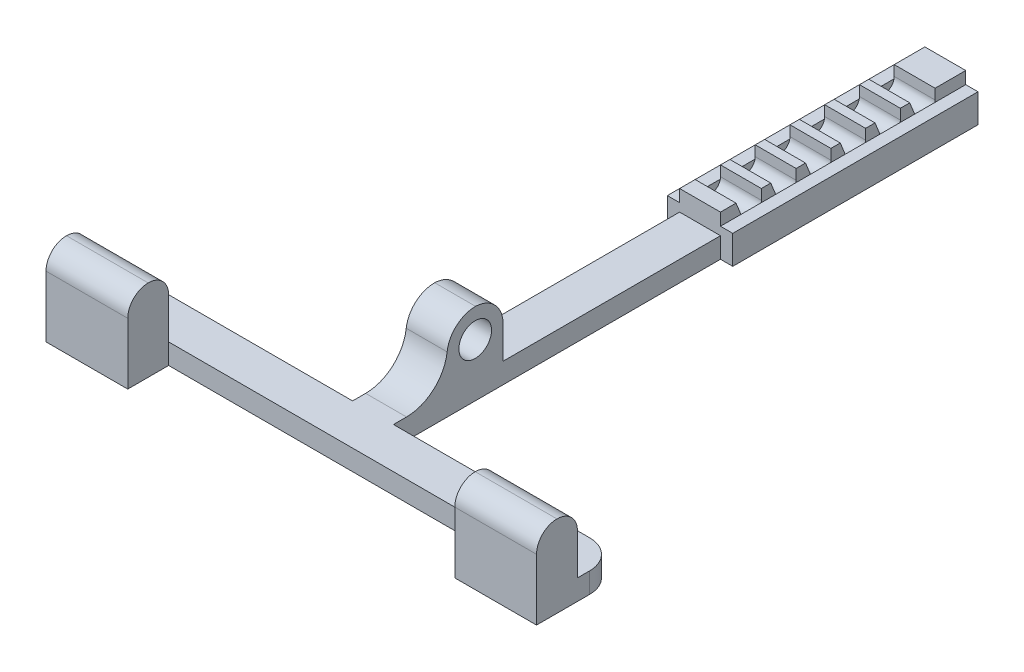
from build123d import *

# Parameters (mm, degrees)
BOSS_EXTRUDE1_DEPTH = 5
SKETCH1_3_W         = 20
SKETCH1_3_H         = 10
SKETCH1_3_W_2       = 10
SKETCH1_3_H_2       = 13.608990902
BOSS_EXTRUDE2_DEPTH = 20
SKETCH1_5_W         = 10
SKETCH1_5_H         = 60
BOSS_EXTRUDE3_DEPTH = 10
SKETCH3_R           = 4
CUT_EXTRUDE1_DEPTH  = 10
FILLET1_R           = 10
FILLET2_R           = 5
FILLET3_R           = 7
FILLET4_R           = 7
FILLET5_R           = 7
SKETCH1_6_W         = 3
SKETCH1_6_H         = 60
BOSS_EXTRUDE4_DEPTH = 7


# Some blends are built 0.0001 mm under size
with BuildPart() as part:
    # Sketch1 → Boss-Extrude1 (new body)
    with BuildSketch(Plane(origin=(0, 0, 0), x_dir=(1, 0, 0), z_dir=(0, 1, 0))):
        Polygon((40, -8.515763432), (40, -18.515763432), (60, -18.515763432), (60, 1.484236568), (5, 1.484236568), (5, 141.484236568), (-5, 141.484236568), (-5, 1.484236568), (-60, 1.484236568), (-60, -18.515763432), (-40, -18.515763432), (-40, -8.515763432), align=None)
    extrude(amount=BOSS_EXTRUDE1_DEPTH)

    # Sketch1<3> → Boss-Extrude2 (add)
    with BuildSketch(Plane(origin=(0, 0, 0), x_dir=(1, 0, 0), z_dir=(0, 1, 0))):
        with Locations((-50, -13.515763432)):
            Rectangle(SKETCH1_3_W, SKETCH1_3_H)
        Polygon((60, -8.515763432), (44.667493795, -8.515763432), (40, -8.515763432), (40, -18.515763432), (60, -18.515763432), align=None)
        with Locations((0, 21.484236568)):
            Rectangle(SKETCH1_3_W_2, SKETCH1_3_H_2)
    extrude(amount=BOSS_EXTRUDE2_DEPTH)

    # Sketch1<5> → Boss-Extrude3 (add)
    with BuildSketch(Plane(origin=(0, 0, 0), x_dir=(1, 0, 0), z_dir=(0, 1, 0))):
        with Locations((0, 111.484236568)):
            Rectangle(SKETCH1_5_W, SKETCH1_5_H)
    extrude(amount=BOSS_EXTRUDE3_DEPTH)

    # Sketch3 → Cut-Extrude1 (cut)
    with BuildSketch(Plane(origin=(5, 0, 0), x_dir=(0, 0, -1), z_dir=(1, 0, 0))):
        with Locations((21.484236568, 13)):
            Circle(SKETCH3_R)
        with BuildLine():
            Line((120.663634314, 6.570050981), (119.289130035, 10))
            Line((119.289130035, 10), (125.484236568, 10))
            Line((125.484236568, 10), (125.484236568, 7.5))
            ThreePointArc((125.484236568, 7.5), (123.457784012, 5.045259114), (120.663634314, 6.570050981))
        make_face()
        with BuildLine():
            Line((133.984236568, 7.5), (133.984236568, 10))
            Line((133.984236568, 10), (127.789130035, 10))
            Line((127.789130035, 10), (129.163634314, 6.570050981))
            ThreePointArc((129.163634314, 6.570050981), (131.957784012, 5.045259114), (133.984236568, 7.5))
        make_face()
        Polygon((141.484236568, 6), (139.984236568, 4.5), (141.484236568, 3), align=None)
        with BuildLine():
            Line((112.163634314, 6.570050981), (110.789130035, 10))
            Line((110.789130035, 10), (116.984236568, 10))
            Line((116.984236568, 10), (116.984236568, 7.5))
            ThreePointArc((116.984236568, 7.5), (114.957784012, 5.045259114), (112.163634314, 6.570050981))
        make_face()
        with BuildLine():
            Line((103.663634314, 6.570050981), (102.289130035, 10))
            Line((102.289130035, 10), (108.484236568, 10))
            Line((108.484236568, 10), (108.484236568, 7.5))
            ThreePointArc((108.484236568, 7.5), (106.457784012, 5.045259114), (103.663634314, 6.570050981))
        make_face()
        with BuildLine():
            Line((95.163634314, 6.570050981), (93.789130035, 10))
            Line((93.789130035, 10), (99.984236568, 10))
            Line((99.984236568, 10), (99.984236568, 7.5))
            ThreePointArc((99.984236568, 7.5), (97.957784012, 5.045259114), (95.163634314, 6.570050981))
        make_face()
        with BuildLine():
            Line((86.663634314, 6.570050981), (85.289130035, 10))
            Line((85.289130035, 10), (91.484236568, 10))
            Line((91.484236568, 10), (91.484236568, 7.5))
            ThreePointArc((91.484236568, 7.5), (89.457784012, 5.045259114), (86.663634314, 6.570050981))
        make_face()
    extrude(amount=-CUT_EXTRUDE1_DEPTH, mode=Mode.SUBTRACT)

    # Fillet1
    fillet1_edges = [part.edges().sort_by_distance(p)[0] for p in [
        (0, 5, -14.679741117),
    ]]
    fillet(fillet1_edges, radius=FILLET1_R)

    # Fillet2
    fillet2_edges = [part.edges().sort_by_distance(p)[0] for p in [
        (-50, 20, 8.515763432),
        (-50, 20, 18.515763432),
        (50, 20, 8.515763432),
        (50, 20, 18.515763432),
    ]]
    fillet(fillet2_edges, radius=FILLET2_R - 0.0001)  # a hair under: the kernel refuses the full size

    # Fillet3
    fillet3_edges = [part.edges().sort_by_distance(p)[0] for p in [
        (0, 20, -14.679741117),
    ]]
    fillet(fillet3_edges, radius=FILLET3_R)

    # Fillet4
    # the kernel refuses this fillet: 7 mm, written as the material it takes off along each edge
    with BuildSketch(Plane(origin=(22.486690858, 20, -28.288732019), x_dir=(0, 0, 1), z_dir=(-1, 0, 0))) as fillet4_piece_1:
        with BuildLine():
            CenterArc((7, -6.994676343), FILLET4_R, 92.234709992, 87.765290008)
            Line((0, -6.994676343), (-0.14, -6.994676343))
            Line((-0.14, -6.994676343), (-0.14, 0))
            Line((-0.14, 0), (0, 0.14))
            ThreePointArc((0, 0.14), (3.363523943, 0.14), (6.721588844, 0.139893527))
            Line((6.721588844, 0.139893527), (6.727047886, 0))
        make_face()
    extrude(amount=44.973381715, mode=Mode.SUBTRACT)

    # Fillet5
    fillet5_edges = [part.edges().sort_by_distance(p)[0] for p in [
        (-60, 2.5, -1.484236568),
        (60, 2.5, -1.484236568),
    ]]
    fillet(fillet5_edges, radius=FILLET5_R)

    # Sketch1<6> → Boss-Extrude4 (add)
    with BuildSketch(Plane(origin=(0, 0, 0), x_dir=(1, 0, 0), z_dir=(0, 1, 0))):
        with Locations((-6.5, 111.484236568)):
            Rectangle(SKETCH1_6_W, SKETCH1_6_H)
        with Locations((6.5, 111.484236568)):
            Rectangle(SKETCH1_6_W, SKETCH1_6_H)
    extrude(amount=BOSS_EXTRUDE4_DEPTH)


solid = part.part
